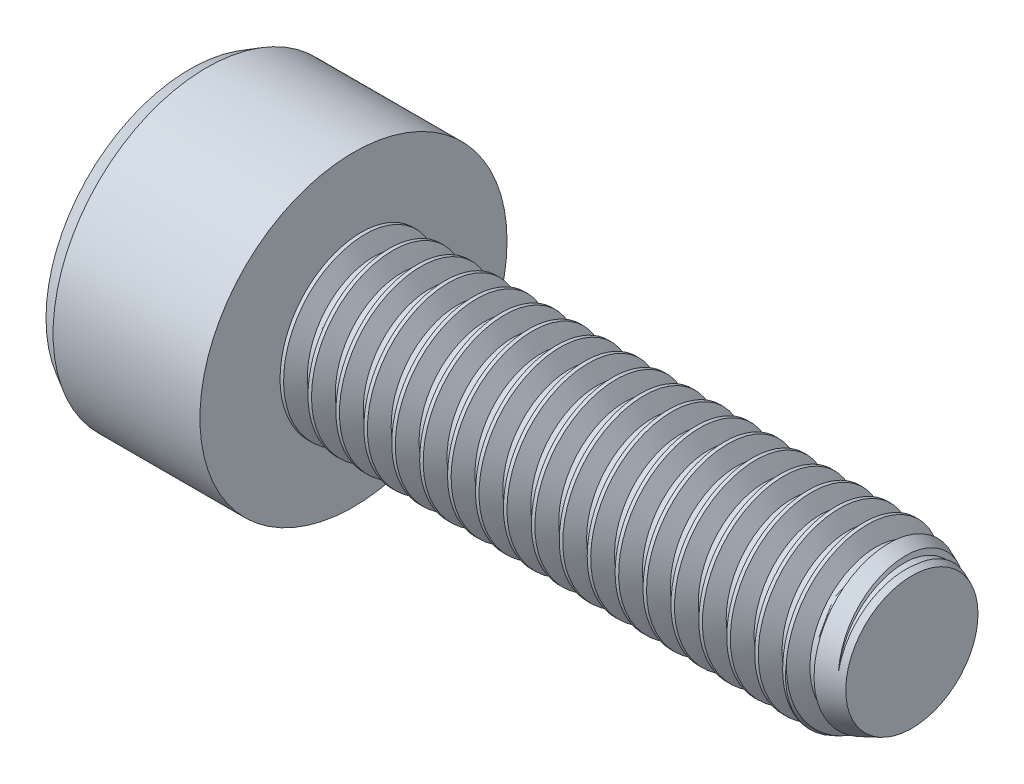
from build123d import *

# Parameters (mm, degrees)
SKETCH2_R           = 1.5
BOSS_EXTRUDE1_DEPTH = 10
CHAMFER1_SIZE       = 0.762
CHAMFER1_SIZE2      = 0.315630735
THREAD1_PITCH       = 0.5
SKETCH5_R           = 2.75
BOSS_EXTRUDE2_DEPTH = 2.93
CUT_EXTRUDE1_DEPTH  = 1.3
CHAMFER2_SIZE       = 0.3
CHAMFER2_SIZE2      = 0.173205081


with BuildPart() as part:
    # Sketch2 → Boss-Extrude1 (new body)
    with BuildSketch(Plane(origin=(0, 0, 0), x_dir=(0, 0, -1), z_dir=(1, 0, 0))):
        Circle(SKETCH2_R)
    extrude(amount=BOSS_EXTRUDE1_DEPTH)

    # Chamfer1
    chamfer1_edges = [part.edges().sort_by_distance(p)[0] for p in [
        (10, 0, 1.5),
    ]]
    chamfer1_side = [part.faces().sort_by_distance(p)[0] for p in [
        (5, 0, 1.5),
    ]]
    chamfer(chamfer1_edges, length=CHAMFER1_SIZE, length2=CHAMFER1_SIZE2, reference=chamfer1_side[0])

    # Thread1: the profile of Thread Profile1 profile screwed along a right-hand helix of 22 turns, 6 arcs to a turn; built about Z, then put on its axis
    thread1_z = Axis((0, 0, 0), (0, 0, 1))
    thread1_corners = [(1.5003, 0, -0.000173205), (1.5003, 0, 0.437673204), (1.229367063, 0, 0.281249999), (1.229367063, 0, 0.156249999)]
    with BuildLine(mode=Mode.PRIVATE) as thread1_profile:
        Line(thread1_corners[0], thread1_corners[1])
        Line(thread1_corners[1], thread1_corners[2])
        Line(thread1_corners[2], thread1_corners[3])
        Line(thread1_corners[3], thread1_corners[0])
    thread1_cap = Face(thread1_profile.wire())
    thread1_turn_angles = [0, 30, 60, 90, 120, 150, 180, 210, 240, 270, 300, 330, 360]
    thread1_turn_weights = [1, 0.8660254037844387, 1, 0.8660254037844387, 1, 0.8660254037844387, 1, 0.8660254037844387, 1, 0.8660254037844387, 1, 0.8660254037844387, 1]
    thread1_turn_rails = [Edge.make_bspline([Vector(p[0], p[1], 0).rotate(thread1_z, thread1_turn_angles[k]) / thread1_turn_weights[k] + Vector(0, 0, p[2] + THREAD1_PITCH * thread1_turn_angles[k] / 360) for k in range(13)], [0, 0, 0, 1, 1, 2, 2, 3, 3, 4, 4, 5, 5, 6, 6, 6], 2, thread1_turn_weights) for p in thread1_corners]
    thread1_turn_sides = [Face.make_surface_from_curves(thread1_turn_rails[p[0]], thread1_turn_rails[p[1]]) for p in [(0, 1), (1, 2), (2, 3), (3, 0)]]
    thread1 = Plane(origin=(-1, 0, 0), x_dir=(0, 0, -1), z_dir=(1, 0, 0)) * Solid(Shell([*[p.moved(Location((0, 0, THREAD1_PITCH * i))) for i in range(22) for p in thread1_turn_sides], thread1_cap, thread1_cap.rotate(thread1_z, 7920).moved(Location((0, 0, THREAD1_PITCH * 7920 / 360)))]))
    add(thread1, mode=Mode.SUBTRACT)

    # Sketch5 → Boss-Extrude2 (add)
    with BuildSketch(Plane.ZY):
        with Locations(Location((0, 0, 0), (0, 0, 180))):
            Circle(SKETCH5_R)
    extrude(amount=BOSS_EXTRUDE2_DEPTH)

    # Sketch6 → Cut-Extrude1 (cut)
    with BuildSketch(Plane.ZY.offset(2.93)):
        Polygon((-0.721687836, 1.25), (-1.443375673, 0), (-0.721687836, -1.25), (0.721687836, -1.25), (1.443375673, 0), (0.721687836, 1.25), align=None)
    extrude(amount=-CUT_EXTRUDE1_DEPTH, mode=Mode.SUBTRACT)

    # Chamfer2
    chamfer2_edges = [part.edges().sort_by_distance(p)[0] for p in [
        (-2.93, 0, 2.75),
    ]]
    chamfer2_side = [part.faces().sort_by_distance(p)[0] for p in [
        (-1.465, 0, 2.75),
    ]]
    chamfer(chamfer2_edges, length=CHAMFER2_SIZE, length2=CHAMFER2_SIZE2, reference=chamfer2_side[0])


solid = part.part
